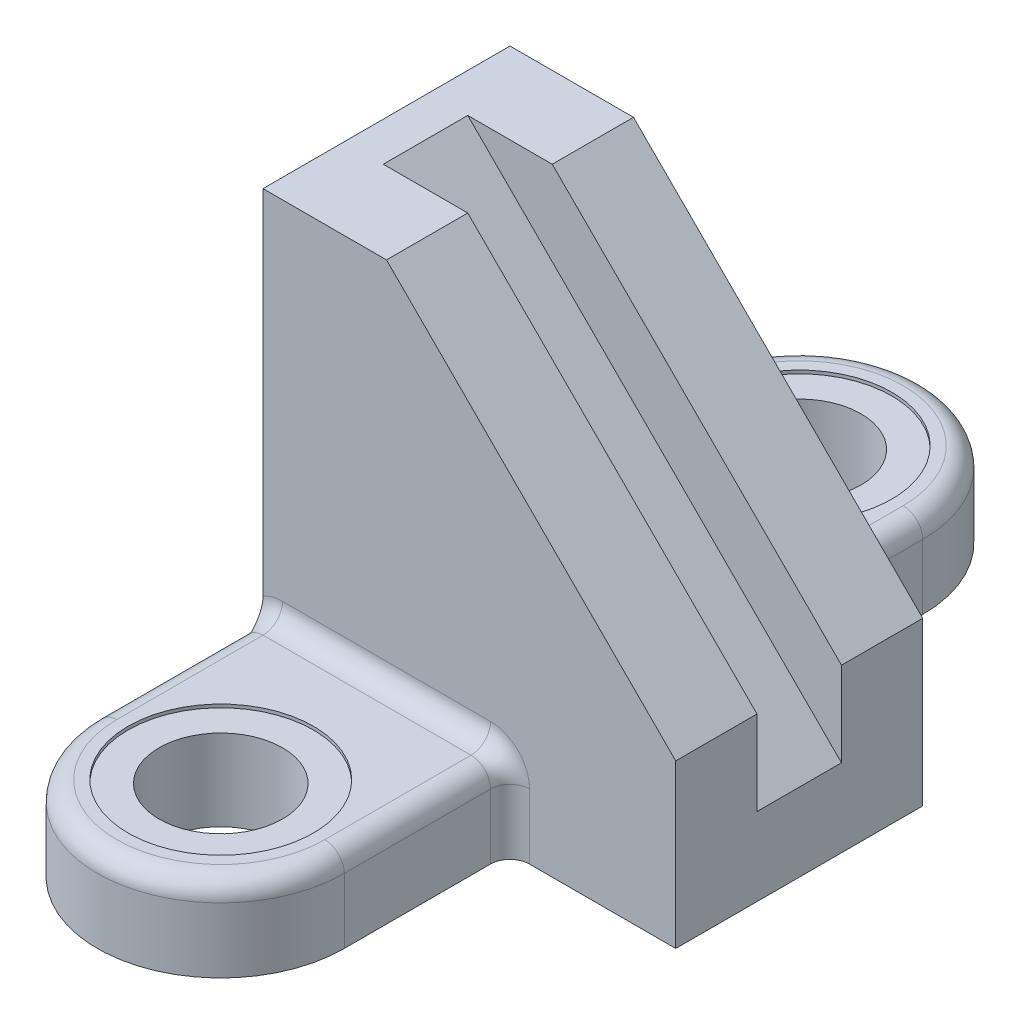
from build123d import *

# Parameters (mm, degrees)
SALIENTE_EXTRUIR1_DEPTH  = 38
CORTAR_EXTRUIR1_DEPTH    = 273.053680503
CROQUIS3_R               = 19
SALIENTE_EXTRUIR3_DEPTH  = 26
REDONDEO1_R              = 6
CROQUIS4_R               = 28.5
CORTAR_EXTRUIR2_DEPTH    = 1
REDONDEO1_OF_SIMETR_A1_R = 6
REDONDEO2_R              = 6


with BuildPart() as part:
    # Croquis1 → Saliente-Extruir1 (new, symmetric)
    with BuildSketch(Plane.XY):
        Polygon((0, 0), (0, 139), (38, 139), (127, 50), (127, 0), align=None)
    extrude(amount=SALIENTE_EXTRUIR1_DEPTH, both=True)

    # Croquis2 → Cortar-Extruir1 (cut, through all, along a direction that is not the sketch's normal)
    with BuildSketch(Plane(origin=(0, 139, 0), x_dir=(1, 0, 0), z_dir=(0, 1, 0))):
        Polygon((38, 0), (38, 13), (12, 13), (12, -13), (38, -13), align=None)
    extrude(amount=-CORTAR_EXTRUIR1_DEPTH, dir=(-0.7071067811865515, 0.7071067811865436, 0), mode=Mode.SUBTRACT)

    # Croquis3 → Saliente-Extruir3 (add)
    with BuildSketch(Plane.XZ):
        with BuildLine():
            Line((0, 38), (0, 89))
            ThreePointArc((0, 89), (38, 127), (76, 89))
            Line((76, 89), (76, 38))
            Line((76, 38), (0, 38))
        make_face()
        with Locations((38, 89)):
            Circle(CROQUIS3_R, mode=Mode.SUBTRACT)
    saliente_extruir3 = extrude(amount=-SALIENTE_EXTRUIR3_DEPTH)

    # Redondeo1
    redondeo1_edges = [part.edges().sort_by_distance(p)[0] for p in [
        (38, 26, 127),
        (76, 26, 63.5),
        (0, 26, 63.5),
    ]]
    fillet(redondeo1_edges, radius=REDONDEO1_R)

    # Croquis4 → Cortar-Extruir2 (cut)
    with BuildSketch(Plane(origin=(0, 26, 0), x_dir=(1, 0, 0), z_dir=(0, 1, 0))):
        with Locations(Location((38, -89, 0), (0, 0, 180))):
            Circle(CROQUIS4_R)
    cortar_extruir2 = extrude(amount=-CORTAR_EXTRUIR2_DEPTH, mode=Mode.SUBTRACT)

    # Simetría1: Saliente-Extruir3, Cortar-Extruir2 across plane
    add(saliente_extruir3.mirror(Plane.XY))
    add(cortar_extruir2.mirror(Plane.XY), mode=Mode.SUBTRACT)

    # Redondeo1 of Simetría1
    redondeo1_of_simetr_a1_edges = [part.edges().sort_by_distance(p)[0] for p in [
        (38, 26, -127),
        (76, 26, -63.5),
        (0, 26, -63.5),
    ]]
    fillet(redondeo1_of_simetr_a1_edges, radius=REDONDEO1_OF_SIMETR_A1_R)

    # Redondeo2
    # the kernel refuses this fillet: 6 mm, written as the material it adds along each edge
    with BuildSketch(Plane(origin=(70, 26, 38), x_dir=(0, 0, 1), z_dir=(-1, 0, 0))) as redondeo2_piece_1:
        with BuildLine():
            CenterArc((REDONDEO2_R, REDONDEO2_R), REDONDEO2_R, 180, 90)
            Line((0, REDONDEO2_R), (0, 0))
            Line((0, 0), (REDONDEO2_R, 0))
        make_face()
    extrude(amount=64)
    with BuildSketch(Plane(origin=(76, 0, 38), x_dir=(0, 0, 1), z_dir=(0, 1, 0))) as redondeo2_piece_2:
        with BuildLine():
            CenterArc((REDONDEO2_R, REDONDEO2_R), REDONDEO2_R, 180, 90)
            Line((0, REDONDEO2_R), (0, 0))
            Line((0, 0), (REDONDEO2_R, 0))
        make_face()
    extrude(amount=20)
    with BuildSketch(Plane(origin=(6, 20, 38), x_dir=(0.8017442392976484, -0.5976672776328276, 0), z_dir=(0.5976672776328276, 0.8017442392976484, 0))) as redondeo2_piece_3_section:
        with BuildLine():
            CenterArc((6 + REDONDEO2_R, -REDONDEO2_R), REDONDEO2_R, 90, 90)
            Line((6 + REDONDEO2_R, 0), (6, 0))
            Line((6, 0), (6, -REDONDEO2_R))
        make_face()
    redondeo2_piece_3 = revolve(axis=Axis((6, 20, 38), (0, 0, -1)), revolution_arc=233.296989237, mode=Mode.PRIVATE)
    redondeo2_piece_3 = split(redondeo2_piece_3, bisect_by=Plane(origin=(0, 24.499633638, 39.86976996), z_dir=(1, 0, 0)), keep=Keep.TOP, mode=Mode.PRIVATE)
    add(redondeo2_piece_3)
    with BuildSketch(Plane(origin=(70, 20, 38), x_dir=(1, 0, 0), z_dir=(0, -1, 0))) as redondeo2_piece_4:
        with BuildLine():
            CenterArc((6 + REDONDEO2_R, REDONDEO2_R), REDONDEO2_R, 180, 90)
            Line((6 + REDONDEO2_R, 0), (6, 0))
            Line((6, 0), (6, REDONDEO2_R))
        make_face()
    revolve(axis=Axis((70, 20, 38), (0, 0, 1)), revolution_arc=90)
    with BuildSketch(Plane(origin=(70, 26, -38), x_dir=(0, 0, -1), z_dir=(-1, 0, 0))) as redondeo2_piece_5:
        with BuildLine():
            CenterArc((REDONDEO2_R, -REDONDEO2_R), REDONDEO2_R, 90, 90)
            Line((0, -REDONDEO2_R), (0, 0))
            Line((0, 0), (REDONDEO2_R, 0))
        make_face()
    extrude(amount=64)
    with BuildSketch(Plane(origin=(76, 0, -38), x_dir=(0, 0, -1), z_dir=(0, 1, 0))) as redondeo2_piece_6:
        with BuildLine():
            CenterArc((REDONDEO2_R, -REDONDEO2_R), REDONDEO2_R, 90, 90)
            Line((0, -REDONDEO2_R), (0, 0))
            Line((0, 0), (REDONDEO2_R, 0))
        make_face()
    extrude(amount=20)
    with BuildSketch(Plane(origin=(6, 20, -38), x_dir=(0.8017442392976486, -0.5976672776328271, 0), z_dir=(0.5976672776328271, 0.8017442392976486, 0))) as redondeo2_piece_7_section:
        with BuildLine():
            CenterArc((6 + REDONDEO2_R, REDONDEO2_R), REDONDEO2_R, 180, 90)
            Line((6, REDONDEO2_R), (6, 0))
            Line((6, 0), (6 + REDONDEO2_R, 0))
        make_face()
    redondeo2_piece_7 = revolve(axis=Axis((6, 20, -38), (0, 0, -1)), revolution_arc=233.296989237, mode=Mode.PRIVATE)
    redondeo2_piece_7 = split(redondeo2_piece_7, bisect_by=Plane(origin=(0, 24.499633653, -39.869769899), z_dir=(1, 0, 0)), keep=Keep.TOP, mode=Mode.PRIVATE)
    add(redondeo2_piece_7)
    with BuildSketch(Plane(origin=(70, 20, -38), x_dir=(1, 0, 0), z_dir=(0, -1, 0))) as redondeo2_piece_8:
        with BuildLine():
            CenterArc((6 + REDONDEO2_R, -REDONDEO2_R), REDONDEO2_R, 90, 90)
            Line((6 + REDONDEO2_R, 0), (6, 0))
            Line((6, 0), (6, -REDONDEO2_R))
        make_face()
    revolve(axis=Axis((70, 20, -38), (0, 0, 1)), revolution_arc=90)


solid = part.part
